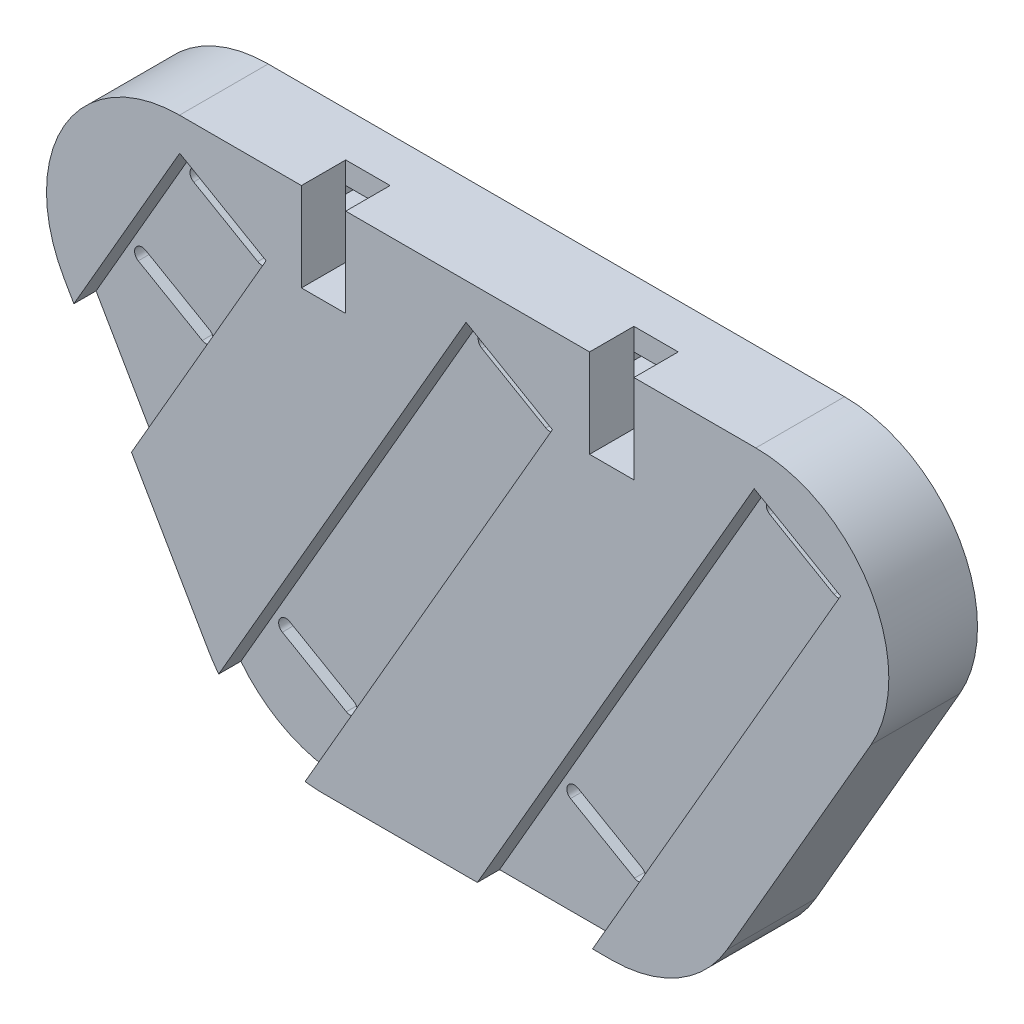
from build123d import *

# Parameters (mm, degrees)
SKETCH1_R           = 7.5
BOSS_EXTRUDE1_DEPTH = 3
BOSS_EXTRUDE2_DEPTH = 1.5
BOSS_EXTRUDE3_DEPTH = 1.5
SKETCH9_W           = 3
SKETCH9_H           = 6
CUT_EXTRUDE4_DEPTH  = 3
SKETCH4_W           = 5
SKETCH4_H           = 1.5
CUT_EXTRUDE5_DEPTH  = 3


with BuildPart() as part:
    # Sketch1 → Boss-Extrude1 (new body)
    with BuildSketch(Plane.XY):
        with BuildLine():
            Line((7.794228634, -4.5), (-1.955771366, -21.387495374))
            ThreePointArc((-1.955771366, -21.387495374), (-5.25, -24.681724008), (-9.75, -25.887495374))
            Line((-9.75, -25.887495374), (-29.25, -25.887495374))
            ThreePointArc((-29.25, -25.887495374), (-33.75, -24.681724008), (-37.044228634, -21.387495374))
            Line((-37.044228634, -21.387495374), (-46.794228634, -4.5))
            ThreePointArc((-46.794228634, -4.5), (-46.794228634, 4.5), (-39, 9))
            Line((-39, 9), (0, 9))
            ThreePointArc((0, 9), (7.794228634, 4.5), (7.794228634, -4.5))
        make_face()
        with Locations((-29.25, -16.887495374)):
            Circle(SKETCH1_R, mode=Mode.SUBTRACT)
        with Locations((-19.5, 0)):
            Circle(SKETCH1_R, mode=Mode.SUBTRACT)
        Circle(SKETCH1_R, mode=Mode.SUBTRACT)
        with Locations((-9.75, -16.887495374)):
            Circle(SKETCH1_R, mode=Mode.SUBTRACT)
        with Locations((-39, 0)):
            Circle(SKETCH1_R, mode=Mode.SUBTRACT)
    extrude(amount=BOSS_EXTRUDE1_DEPTH)

    # Sketch2 → Boss-Extrude2 (add)
    with BuildSketch(Plane.XY.offset(3)):
        with BuildLine():
            ThreePointArc((-9.75, -25.887495374), (-5.25, -24.681724008), (-1.955771366, -21.387495374))
            Line((-1.955771366, -21.387495374), (7.794228634, -4.5))
            ThreePointArc((7.794228634, -4.5), (7.794228634, 4.5), (0, 9))
            Line((0, 9), (-39, 9))
            ThreePointArc((-39, 9), (-46.794228634, 4.5), (-46.794228634, -4.5))
            Line((-46.794228634, -4.5), (-37.044228634, -21.387495374))
            ThreePointArc((-37.044228634, -21.387495374), (-33.75, -24.681724008), (-29.25, -25.887495374))
            Line((-29.25, -25.887495374), (-9.75, -25.887495374))
        make_face()
        with BuildLine():
            Line((-29.209936491, -21.81810334), (-33.540063509, -19.31810334))
            ThreePointArc((-33.540063509, -19.31810334), (-33.723076211, -18.635090638), (-33.040063509, -18.452077936))
            Line((-33.040063509, -18.452077936), (-28.709936491, -20.952077936))
            ThreePointArc((-28.709936491, -20.952077936), (-28.526923789, -21.635090638), (-29.209936491, -21.81810334))
        make_face(mode=Mode.SUBTRACT)
        with BuildLine():
            Line((-9.709936491, -21.81810334), (-14.040063509, -19.31810334))
            ThreePointArc((-14.040063509, -19.31810334), (-14.223076211, -18.635090638), (-13.540063509, -18.452077936))
            Line((-13.540063509, -18.452077936), (-9.209936491, -20.952077936))
            ThreePointArc((-9.209936491, -20.952077936), (-9.026923789, -21.635090638), (-9.709936491, -21.81810334))
        make_face(mode=Mode.SUBTRACT)
        with BuildLine():
            Line((-35.209936491, 1.564582562), (-39.540063509, 4.064582562))
            ThreePointArc((-39.540063509, 4.064582562), (-39.723076211, 4.747595264), (-39.040063509, 4.930607966))
            Line((-39.040063509, 4.930607966), (-34.709936491, 2.430607966))
            ThreePointArc((-34.709936491, 2.430607966), (-34.526923789, 1.747595264), (-35.209936491, 1.564582562))
        make_face(mode=Mode.SUBTRACT)
        with BuildLine():
            ThreePointArc((-38.459936491, -4.064582562), (-38.276923789, -4.747595264), (-38.959936491, -4.930607966))
            Line((-38.959936491, -4.930607966), (-43.290063509, -2.430607966))
            ThreePointArc((-43.290063509, -2.430607966), (-43.473076211, -1.747595264), (-42.790063509, -1.564582562))
            Line((-42.790063509, -1.564582562), (-38.459936491, -4.064582562))
        make_face(mode=Mode.SUBTRACT)
        with BuildLine():
            Line((-15.709936491, 1.564582562), (-20.040063509, 4.064582562))
            ThreePointArc((-20.040063509, 4.064582562), (-20.223076211, 4.747595264), (-19.540063509, 4.930607966))
            Line((-19.540063509, 4.930607966), (-15.209936491, 2.430607966))
            ThreePointArc((-15.209936491, 2.430607966), (-15.026923789, 1.747595264), (-15.709936491, 1.564582562))
        make_face(mode=Mode.SUBTRACT)
        with BuildLine():
            Line((3.790063509, 1.564582562), (-0.540063509, 4.064582562))
            ThreePointArc((-0.540063509, 4.064582562), (-0.723076211, 4.747595264), (-0.040063509, 4.930607966))
            Line((-0.040063509, 4.930607966), (4.290063509, 2.430607966))
            ThreePointArc((4.290063509, 2.430607966), (4.473076211, 1.747595264), (3.790063509, 1.564582562))
        make_face(mode=Mode.SUBTRACT)
    extrude(amount=BOSS_EXTRUDE2_DEPTH)

    # Sketch3 → Boss-Extrude3 (add)
    with BuildSketch(Plane.XY.offset(4.5)):
        with BuildLine():
            ThreePointArc((-39, 9), (-46.794228634, 4.5), (-46.794228634, -4.5))
            Line((-46.794228634, -4.5), (-46.144709581, -5.625))
            Line((-46.144709581, -5.625), (-38.985335738, 6.775399247))
            Line((-38.985335738, 6.775399247), (-33.139664262, 3.400399247))
            Line((-33.139664262, 3.400399247), (-42.247595264, -12.375))
            Line((-42.247595264, -12.375), (-37.044228634, -21.387495374))
            ThreePointArc((-37.044228634, -21.387495374), (-36.712405778, -21.918648323), (-36.344447387, -22.425438699))
            Line((-36.344447387, -22.425438699), (-34.985335738, -20.07138827))
            Line((-34.985335738, -20.07138827), (-19.610335738, 6.558892896))
            Line((-19.610335738, 6.558892896), (-13.764664262, 3.183892896))
            Line((-13.764664262, 3.183892896), (-29.139664262, -23.44638827))
            Line((-29.139664262, -23.44638827), (-30.498775911, -25.800438699))
            ThreePointArc((-30.498775911, -25.800438699), (-29.875903375, -25.865704826), (-29.25, -25.887495374))
            Line((-29.25, -25.887495374), (-18.84326674, -25.887495374))
            Line((-18.84326674, -25.887495374), (-15.485335738, -20.07138827))
            Line((-15.485335738, -20.07138827), (-0.110335738, 6.558892896))
            Line((-0.110335738, 6.558892896), (5.735335738, 3.183892896))
            Line((5.735335738, 3.183892896), (-9.639664262, -23.44638827))
            Line((-9.639664262, -23.44638827), (-11.049038106, -25.887495374))
            Line((-11.049038106, -25.887495374), (-9.75, -25.887495374))
            ThreePointArc((-9.75, -25.887495374), (-5.25, -24.681724008), (-1.955771366, -21.387495374))
            Line((-1.955771366, -21.387495374), (7.794228634, -4.5))
            ThreePointArc((7.794228634, -4.5), (7.794228634, 4.5), (0, 9))
            Line((0, 9), (-39, 9))
        make_face()
    extrude(amount=BOSS_EXTRUDE3_DEPTH)

    # Sketch9 → Cut-Extrude4 (cut)
    with BuildSketch(Plane.XY.offset(6)):
        with Locations((-29.25, 6)):
            Rectangle(SKETCH9_W, SKETCH9_H)
        with Locations((-9.75, 6)):
            Rectangle(SKETCH9_W, SKETCH9_H)
    extrude(amount=-CUT_EXTRUDE4_DEPTH, mode=Mode.SUBTRACT)

    # Sketch4 → Cut-Extrude5 (cut)
    with BuildSketch(Plane(origin=(0, 0, 0), x_dir=(-1, 0, 0), z_dir=(0, 0, -1))):
        with Locations((19.5, -23.637495374)):
            Rectangle(SKETCH4_W, SKETCH4_H)
        with Locations((9.75, 6.75)):
            Rectangle(SKETCH4_W, SKETCH4_H)
        with Locations((29.25, 6.75)):
            Rectangle(SKETCH4_W, SKETCH4_H)
        Polygon((39.370190528, -14.358811196), (41.870190528, -10.028684177), (40.571152423, -9.278684177), (38.071152423, -13.608811196), align=None)
        Polygon((-2.870190528, -10.028684177), (-0.370190528, -14.358811196), (0.928847577, -13.608811196), (-1.571152423, -9.278684177), align=None)
    extrude(amount=-CUT_EXTRUDE5_DEPTH, mode=Mode.SUBTRACT)


solid = part.part
